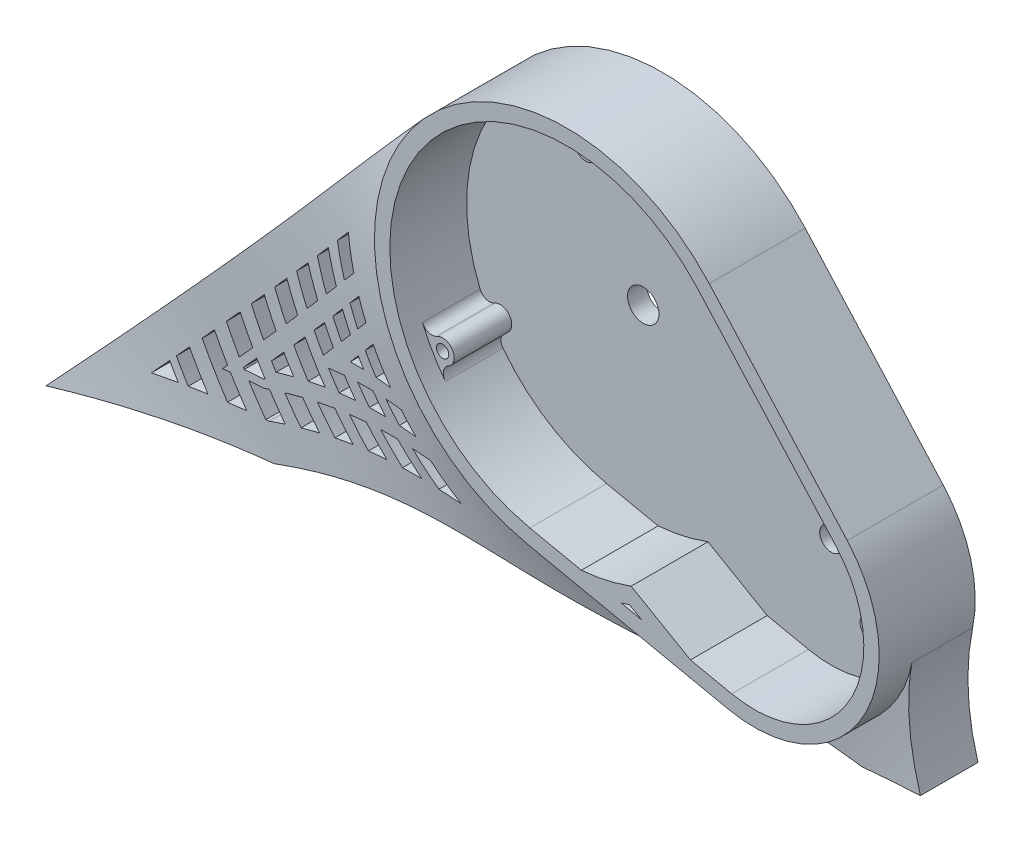
from build123d import *

# Parameters (mm, degrees)
SKETCH1_R           = 32.5
SKETCH1_R_2         = 50
BOSS_EXTRUDE1_DEPTH = 5
BOSS_EXTRUDE3_DEPTH = 20
SKETCH5_R           = 4.1
SKETCH5_R_2         = 3
CUT_EXTRUDE1_DEPTH  = 20
SKETCH6_R           = 3
SKETCH6_R_2         = 1.6
BOSS_EXTRUDE8_DEPTH = 20
CUT_EXTRUDE4_START  = -5
SKETCH8_R           = 46
SKETCH8_R_2         = 28.5
SKETCH8_R_3         = 1.6
CUT_EXTRUDE4_DEPTH  = 5
BOSS_EXTRUDE9_DEPTH = 10
FILLET1_R           = 60
FILLET2_R           = 290
REVOLVE1_ANGLE      = 247
CUT_EXTRUDE7_DEPTH  = 60
CUT_EXTRUDE8_START  = -20
CUT_EXTRUDE8_DEPTH  = 20
SKETCH13_R          = 2
CUT_EXTRUDE9_DEPTH  = 30
SKETCH14_R          = 3.75
CUT_EXTRUDE10_DEPTH = 20
CUT_EXTRUDE11_DEPTH = 30


with BuildPart() as part:
    # Sketch1 → Boss-Extrude1 (new body)
    # profile 1 of 9: a face of its own
    with BuildSketch(Plane.XY):
        with Locations((48.930435314, -28.25)):
            Circle(SKETCH1_R)
    # profile 2 of 9: a face of its own
    with BuildSketch(Plane.XY):
        Circle(SKETCH1_R_2)
    # profile 3 of 9: a face of its own
    with BuildSketch(Plane.XY):
        with Locations((48.930435314, -28.25)):
            Circle(SKETCH1_R)
    # profile 4 of 9: a face of its own
    with BuildSketch(Plane.XY):
        Circle(SKETCH1_R_2)
    # profile 5 of 9: a face of its own
    with BuildSketch(Plane.XY):
        with BuildLine():
            ThreePointArc((21.239981735, -45.264369827), (18.971346468, -46.261085301), (16.656116453, -47.144180815))
            Line((16.656116453, -47.144180815), (32.680435314, -56.395825623))
            ThreePointArc((32.680435314, -56.395825623), (26.266186105, -51.543385495), (21.239981735, -45.264369827))
        make_face()
    # profile 6 of 9: a face of its own
    with BuildSketch(Plane.XY):
        with BuildLine():
            ThreePointArc((16.656116453, -47.144180815), (3.270866111, -49.892899644), (-10.358679178, -48.915209963))
            Line((-10.358679178, -48.915209963), (42.197293848, -60.044886476))
            ThreePointArc((42.197293848, -60.044886476), (37.294924617, -58.59575573), (32.680435314, -56.395825623))
            Line((32.680435314, -56.395825623), (16.656116453, -47.144180815))
        make_face()
        with BuildLine():
            Line((16.444398644, -49.331346558), (19.648032231, -51.180965272))
            Line((19.648032231, -51.180965272), (14.192631254, -50.025685584))
            ThreePointArc((14.192631254, -50.025685584), (15.322448463, -49.691272605), (16.444398644, -49.331346558))
        make_face(mode=Mode.SUBTRACT)
    # profile 7 of 9: a face of its own
    with BuildSketch(Plane.XY):
        Circle(SKETCH1_R_2)
    # profile 8 of 9: a face of its own
    with BuildSketch(Plane.XY):
        with Locations((48.930435314, -28.25)):
            Circle(SKETCH1_R)
    # profile 9 of 9: a face of its own
    with BuildSketch(Plane.XY):
        with BuildLine():
            Line((73.099043979, -6.521485206), (37.18247487, 33.428484299))
            ThreePointArc((37.18247487, 33.428484299), (45.884475161, 19.864917298), (49.820085025, 4.237821155))
            ThreePointArc((49.820085025, 4.237821155), (62.565674459, 1.251360197), (73.099043979, -6.521485206))
        make_face()
    extrude(amount=BOSS_EXTRUDE1_DEPTH)

    # Sketch2 → Boss-Extrude3 (add)
    # profile 1 of 2: a face of its own
    with BuildSketch(Plane.XY.offset(5)):
        with BuildLine():
            ThreePointArc((37.18247487, 33.428484299), (-43.301270189, 25), (-10.358679178, -48.915209963))
            Line((-10.358679178, -48.915209963), (42.197293848, -60.044886476))
            ThreePointArc((42.197293848, -60.044886476), (77.076260937, -44.5), (73.099043979, -6.521485206))
            Line((73.099043979, -6.521485206), (37.18247487, 33.428484299))
        make_face()
        with BuildLine():
            Line((32.282132176, -53.856464122), (19.648032231, -51.180965272))
            Line((19.648032231, -51.180965272), (14.192631254, -50.025685584))
            Line((14.192631254, -50.025685584), (3.883846525, -47.842614228))
            Line((3.883846525, -47.842614228), (-9.529984844, -45.001993166))
            ThreePointArc((-9.529984844, -45.001993166), (-39.837168574, 23), (34.207876881, 30.754205555))
            Line((34.207876881, 30.754205555), (70.12444599, -9.19576395))
            ThreePointArc((70.12444599, -9.19576395), (73.612159322, -42.5), (43.025988182, -56.131669679))
            Line((43.025988182, -56.131669679), (32.282132176, -53.856464122))
        make_face(mode=Mode.SUBTRACT)
    # profile 2 of 2: a face of its own
    with BuildSketch(Plane.XY.offset(5)):
        with BuildLine():
            Line((16.444398644, -49.331346558), (19.648032231, -51.180965272))
            Line((19.648032231, -51.180965272), (32.282132176, -53.856464122))
            Line((32.282132176, -53.856464122), (16.848481272, -44.945841619))
            ThreePointArc((16.848481272, -44.945841619), (10.466860889, -46.844901784), (3.883846525, -47.842614228))
            Line((3.883846525, -47.842614228), (14.192631254, -50.025685584))
            ThreePointArc((14.192631254, -50.025685584), (15.322448463, -49.691272605), (16.444398644, -49.331346558))
        make_face()
    extrude(amount=BOSS_EXTRUDE3_DEPTH)

    # Sketch5 → Cut-Extrude1 (cut)
    with BuildSketch(Plane.XY.offset(5)):
        Circle(SKETCH5_R)
        with Locations((48.930435314, -28.25)):
            Circle(SKETCH5_R_2)
    extrude(amount=-CUT_EXTRUDE1_DEPTH, mode=Mode.SUBTRACT)

    # Sketch6 → Boss-Extrude8 (add)
    # profile 1 of 10: a face of its own
    with BuildSketch(Plane.XY.offset(5)):
        with BuildLine():
            ThreePointArc((-35.739092363, -24.098076211), (-38.015549649, -24.397777438), (-39.83716873, -22.99999973))
            ThreePointArc((-39.83716873, -22.99999973), (-38.255897926, -25.543810873), (-36.512430205, -27.97932166))
            ThreePointArc((-36.512430205, -27.97932166), (-37.004666308, -25.86357718), (-35.739092363, -24.098076211))
        make_face()
    # profile 2 of 10: a face of its own
    with BuildSketch(Plane.XY.offset(5)):
        with Locations((-37.239092363, -21.5)):
            Circle(SKETCH6_R)
        with Locations((-37.239092363, -21.5)):
            Circle(SKETCH6_R_2, mode=Mode.SUBTRACT)
    # profile 3 of 10: a face of its own
    with BuildSketch(Plane.XY.offset(5)):
        with BuildLine():
            ThreePointArc((-38.739092363, -18.901923789), (-40.900848025, -19.115192491), (-42.48701844, -17.631031282))
            ThreePointArc((-42.48701844, -17.631031282), (-41.249538226, -20.358673732), (-39.83716873, -22.99999973))
            ThreePointArc((-39.83716873, -22.99999973), (-40.136869801, -20.723542714), (-38.739092363, -18.901923789))
        make_face()
    # profile 4 of 10: a face of its own
    with BuildSketch(Plane.XY.offset(5)):
        with BuildLine():
            ThreePointArc((-7e-09, 46), (2.121320341, 45.121320346), (3, 43))
            ThreePointArc((3, 43), (3.896181717, 44.978769671), (5.974588235, 45.610352941))
            ThreePointArc((5.974588235, 45.610352941), (2.993640314, 45.902484875), (-7e-09, 46))
        make_face()
    # profile 5 of 10: a face of its own
    with BuildSketch(Plane.XY.offset(5)):
        with Locations((0, 43)):
            Circle(SKETCH6_R)
        with Locations((0, 43)):
            Circle(SKETCH6_R_2, mode=Mode.SUBTRACT)
    # profile 6 of 10: a face of its own
    with BuildSketch(Plane.XY.offset(5)):
        with BuildLine():
            ThreePointArc((-5.974588235, 45.610352941), (-3.896181717, 44.978769671), (-3, 43))
            ThreePointArc((-3, 43), (-2.121320346, 45.121320341), (-7e-09, 46))
            ThreePointArc((-7e-09, 46), (-2.993640321, 45.902484874), (-5.974588235, 45.610352941))
        make_face()
    # profile 7 of 10: a face of its own
    with BuildSketch(Plane.XY.offset(5)):
        with BuildLine():
            Line((77.272100755, -31.25), (74.430435314, -31.25))
            ThreePointArc((74.430435314, -31.25), (76.31803, -32.150518588), (76.80577778, -34.184246575))
            ThreePointArc((76.80577778, -34.184246575), (77.077201474, -32.723204081), (77.272100755, -31.25))
        make_face()
    # profile 8 of 10: a face of its own
    with BuildSketch(Plane.XY.offset(5)):
        with BuildLine():
            ThreePointArc((77.430435314, -28.25), (76.551755657, -30.371320344), (74.430435314, -31.25))
            Line((74.430435314, -31.25), (77.272100755, -31.25))
            ThreePointArc((77.272100755, -31.25), (77.390824147, -29.7520877), (77.430435314, -28.25))
        make_face()
    # profile 9 of 10: a face of its own
    with BuildSketch(Plane.XY.offset(5)):
        with Locations((74.430435314, -28.25)):
            Circle(SKETCH6_R)
        with Locations((74.430435314, -28.25)):
            Circle(SKETCH6_R_2, mode=Mode.SUBTRACT)
    # profile 10 of 10: a face of its own
    with BuildSketch(Plane.XY.offset(5)):
        with BuildLine():
            ThreePointArc((76.80577778, -22.315753425), (76.31803, -24.349481412), (74.430435314, -25.25))
            ThreePointArc((74.430435314, -25.25), (76.551755657, -26.128679656), (77.430435314, -28.25))
            ThreePointArc((77.430435314, -28.25), (77.273840722, -25.266483641), (76.80577778, -22.315753425))
        make_face()
    extrude(amount=BOSS_EXTRUDE8_DEPTH)

    # Sketch8 → Cut-Extrude4 (cut)
    # profile 1 of 7: a face of its own
    with BuildSketch(Plane.XY.offset(25).offset(CUT_EXTRUDE4_START)):
        with BuildLine():
            ThreePointArc((45.999893614, 0.098931644), (42.933181417, 16.514900345), (34.207876881, 30.754205555))
            ThreePointArc((34.207876881, 30.754205555), (21.420408598, 40.708304994), (5.974588235, 45.610352941))
            ThreePointArc((5.974588235, 45.610352941), (3.896181717, 44.978769671), (3, 43))
            ThreePointArc((3, 43), (0, 40), (-3, 43))
            ThreePointArc((-3, 43), (-3.896181717, 44.978769671), (-5.974588235, 45.610352941))
            ThreePointArc((-5.974588235, 45.610352941), (-39.837168574, 23), (-42.48701844, -17.631031282))
            ThreePointArc((-42.48701844, -17.631031282), (-40.900848025, -19.115192491), (-38.739092363, -18.901923789))
            ThreePointArc((-38.739092363, -18.901923789), (-34.641016151, -20), (-35.739092363, -24.098076211))
            ThreePointArc((-35.739092363, -24.098076211), (-37.004666308, -25.86357718), (-36.512430205, -27.97932166))
            ThreePointArc((-36.512430205, -27.97932166), (-24.544221971, -38.904770502), (-9.529984844, -45.001993166))
            ThreePointArc((-9.529984844, -45.001993166), (7.164267468, -45.438675945), (22.91426949, -39.886542263))
            ThreePointArc((22.91426949, -39.886542263), (24.248711306, -14), (45.999893614, 0.098931644))
        make_face()
    # profile 2 of 7: a face of its own
    with BuildSketch(Plane.XY.offset(25).offset(CUT_EXTRUDE4_START)):
        with BuildLine():
            ThreePointArc((70.12444599, -9.19576395), (59.176723242, -1.655572319), (45.999893614, 0.098931644))
            ThreePointArc((45.999893614, 0.098931644), (45.999973404, 0.049465851), (46, 0))
            ThreePointArc((46, 0), (39.812412616, -23.042825385), (22.91426949, -39.886542263))
            ThreePointArc((22.91426949, -39.886542263), (31.022129307, -50.420759481), (43.025988182, -56.131669679))
            ThreePointArc((43.025988182, -56.131669679), (64.457907924, -52.148694406), (76.80577778, -34.184246575))
            ThreePointArc((76.80577778, -34.184246575), (76.31803, -32.150518588), (74.430435314, -31.25))
            ThreePointArc((74.430435314, -31.25), (71.430435314, -28.25), (74.430435314, -25.25))
            ThreePointArc((74.430435314, -25.25), (76.31803, -24.349481412), (76.80577778, -22.315753425))
            ThreePointArc((76.80577778, -22.315753425), (74.326968254, -15.316859832), (70.12444599, -9.19576395))
        make_face()
    # profile 3 of 7: a face of its own
    with BuildSketch(Plane.XY.offset(25).offset(CUT_EXTRUDE4_START)):
        Circle(SKETCH8_R)
    # profile 4 of 7: a face of its own
    with BuildSketch(Plane.XY.offset(25).offset(CUT_EXTRUDE4_START)):
        with Locations((48.930435314, -28.25)):
            Circle(SKETCH8_R_2)
    # profile 5 of 7: a face of its own
    with BuildSketch(Plane.XY.offset(25).offset(CUT_EXTRUDE4_START)):
        with BuildLine():
            ThreePointArc((3, 43), (3.896181717, 44.978769671), (5.974588235, 45.610352941))
            ThreePointArc((5.974588235, 45.610352941), (0, 46), (-5.974588235, 45.610352941))
            ThreePointArc((-5.974588235, 45.610352941), (-3.896181717, 44.978769671), (-3, 43))
            ThreePointArc((-3, 43), (0, 40), (3, 43))
        make_face()
        with Locations((0, 43)):
            Circle(SKETCH8_R_3, mode=Mode.SUBTRACT)
    # profile 6 of 7: a face of its own
    with BuildSketch(Plane.XY.offset(25).offset(CUT_EXTRUDE4_START)):
        with BuildLine():
            ThreePointArc((-38.739092363, -18.901923789), (-40.900848025, -19.115192491), (-42.48701844, -17.631031282))
            ThreePointArc((-42.48701844, -17.631031282), (-39.837168574, -23), (-36.512430205, -27.97932166))
            ThreePointArc((-36.512430205, -27.97932166), (-37.004666308, -25.86357718), (-35.739092363, -24.098076211))
            ThreePointArc((-35.739092363, -24.098076211), (-34.641016151, -20), (-38.739092363, -18.901923789))
        make_face()
        with Locations((-37.239092363, -21.5)):
            Circle(SKETCH8_R_3, mode=Mode.SUBTRACT)
    # profile 7 of 7: a face of its own
    with BuildSketch(Plane.XY.offset(25).offset(CUT_EXTRUDE4_START)):
        with BuildLine():
            ThreePointArc((77.430435314, -28.25), (77.273840722, -25.266483641), (76.80577778, -22.315753425))
            ThreePointArc((76.80577778, -22.315753425), (76.31803, -24.349481412), (74.430435314, -25.25))
            ThreePointArc((74.430435314, -25.25), (71.430435314, -28.25), (74.430435314, -31.25))
            ThreePointArc((74.430435314, -31.25), (76.31803, -32.150518588), (76.80577778, -34.184246575))
            ThreePointArc((76.80577778, -34.184246575), (77.273840722, -31.233516359), (77.430435314, -28.25))
        make_face()
        with Locations((74.430435314, -28.25)):
            Circle(SKETCH8_R_3, mode=Mode.SUBTRACT)
    extrude(amount=CUT_EXTRUDE4_DEPTH, mode=Mode.SUBTRACT)

    # Sketch9 → Boss-Extrude9 (add)
    with BuildSketch(Plane(origin=(0, 0, 0), x_dir=(-1, 0, 0), z_dir=(0, 0, -1))):
        with BuildLine():
            Line((-67.172494488, -65.333836294), (-42.197293848, -60.044886476))
            ThreePointArc((-42.197293848, -60.044886476), (-61.327866171, -58.292531653), (-76.12682551, -46.043435877))
            Line((-76.12682551, -46.043435877), (-82.151340904, -64.537494637))
            Line((-82.151340904, -64.537494637), (-67.172494488, -65.333836294))
        make_face()
        with BuildLine():
            ThreePointArc((37.18247487, 33.428484299), (47.541154048, -15.486725664), (10.358679178, -48.915209963))
            Line((10.358679178, -48.915209963), (85.711958323, -73.461849298))
            Line((85.711958323, -73.461849298), (135.668803504, -76.117775913))
            Line((135.668803504, -76.117775913), (37.18247487, 33.428484299))
        make_face()
    extrude(amount=-BOSS_EXTRUDE9_DEPTH)

    # Fillet1
    # the kernel refuses this fillet: 60 mm, written as the material it adds along each edge
    with BuildSketch(Plane(origin=(76.12682551, -46.043435877, 0), x_dir=(0.3815886364407495, 0.9243322522444457, 0), z_dir=(0, 0, 1))) as fillet1_piece_1_section:
        with BuildLine():
            CenterArc((23.343127723, -58.944504991), FILLET1_R, 100.762888002, 28.705193909)
            Line((-14.795768372, -12.625776548), (-15.558546294, -11.699401979))
            ThreePointArc((-15.558546294, -11.699401979), (-8.176829246, -5.400065951), (-0.77894506, 0.912822323))
            Line((-0.77894506, 0.912822323), (0.224094026, 1.1788901))
            ThreePointArc((0.224094026, 1.1788901), (6.069213208, 0.628273537), (11.91433239, 1.1788901))
            Line((11.91433239, 1.1788901), (12.138426416, 0))
        make_face()
    fillet1_piece_1 = extrude(amount=10, mode=Mode.PRIVATE)
    fillet1_piece_1 = split(fillet1_piece_1, bisect_by=Plane(origin=(79.381235525, -64.684765678, 5), z_dir=(-0.05308944378918359, 0.998589761092189, 0)), keep=Keep.TOP, mode=Mode.PRIVATE)
    add(fillet1_piece_1)

    # Fillet2
    # the kernel refuses this fillet: 290 mm, written as the material it adds along each edge
    with BuildSketch(Plane(origin=(-10.358679178, -48.915209963, 10), x_dir=(0.9783041992533178, -0.20717358355573395, 0), z_dir=(0, 0, -1))) as fillet2_piece_1:
        with BuildLine():
            CenterArc((FILLET2_R * 0.267949192431, FILLET2_R), FILLET2_R, 240, 30)
            Line((-FILLET2_R * 0.232050807569, FILLET2_R * 0.133974596216), (0, 0))
            Line((0, 0), (FILLET2_R * 0.267949192431, 0))
        make_face()
    extrude(amount=10)

    # Sketch10 → Revolve1 (revolve)
    with BuildSketch(Plane(origin=(0, 0, 0), x_dir=(0, 0, -1), z_dir=(1, 0, 0))):
        with BuildLine():
            Line((-25, 50), (-5, 50))
            Line((-5, 50), (-5, 103))
            Line((-5, 103), (-15, 103))
            ThreePointArc((-15, 103), (-17.521862462, 76.03242688), (-25, 50))
        make_face()
        with BuildLine():
            Line((-15, 103), (-5, 103))
            Line((-5, 103), (-5, 156))
            Line((-5, 156), (-25, 156))
            ThreePointArc((-25, 156), (-17.521862462, 129.96757312), (-15, 103))
        make_face()
    revolve(axis=Axis((0, 0, 0), (0, 0, 1)), revolution_arc=REVOLVE1_ANGLE)

    # Sketch11 → Cut-Extrude7 (cut)
    with BuildSketch(Plane(origin=(0, 0, 0), x_dir=(-1, 0, 0), z_dir=(0, 0, -1))):
        with BuildLine():
            Line((-65.660708663, -65.013688341), (-67.172494488, -65.333836294))
            Line((-67.172494488, -65.333836294), (-82.151340904, -64.537494637))
            ThreePointArc((-82.151340904, -64.537494637), (-79.58439421, -49.768168146), (-80.758711095, -34.823496849))
            ThreePointArc((-80.758711095, -34.823496849), (-80.80940732, -34.573064434), (-80.858133115, -34.322241193))
            Line((-80.858133115, -34.322241193), (-143.598757139, -60.954056044))
            ThreePointArc((-143.598757139, -60.954056044), (130.086188242, -86.102169709), (0, 156))
            Line((0, 156), (0, 50))
            ThreePointArc((0, 50), (20.354063293, 45.66959719), (37.18247487, 33.428484299))
            Line((37.18247487, 33.428484299), (135.668803504, -76.117775913))
            Line((135.668803504, -76.117775913), (85.711958323, -73.461849298))
            Line((85.711958323, -73.461849298), (84.242639417, -72.983212646))
            ThreePointArc((84.242639417, -72.983212646), (9.815569267, -59.130875407), (-65.660708663, -65.013688341))
        make_face()
    extrude(amount=-CUT_EXTRUDE7_DEPTH, mode=Mode.SUBTRACT)

    # Sketch12 → Cut-Extrude8 (cut)
    with BuildSketch(Plane.XY.offset(25).offset(CUT_EXTRUDE8_START)):
        with BuildLine():
            ThreePointArc((76.80577778, -34.184246575), (76.831751455, -33.315749192), (76.550347071, -32.493694504))
            Line((76.550347071, -32.493694504), (46.025242673, -19.536556424))
            ThreePointArc((46.025242673, -19.536556424), (35.172990594, -35.536751859), (19.061987701, -46.223810151))
            Line((19.061987701, -46.223810151), (32.282132176, -53.856464122))
            Line((32.282132176, -53.856464122), (43.025988182, -56.131669679))
            ThreePointArc((43.025988182, -56.131669679), (64.457907924, -52.148694406), (76.80577778, -34.184246575))
        make_face()
        with BuildLine():
            Line((19.648032231, -51.180965272), (14.192631254, -50.025685584))
            ThreePointArc((14.192631254, -50.025685584), (15.322448463, -49.691272605), (16.444398644, -49.331346558))
            Line((16.444398644, -49.331346558), (19.648032231, -51.180965272))
        make_face()
        with BuildLine():
            Line((46.025242673, -19.536556424), (76.550347071, -32.493694504))
            ThreePointArc((76.550347071, -32.493694504), (75.659337453, -31.583873666), (74.430435314, -31.25))
            ThreePointArc((74.430435314, -31.25), (71.430435314, -28.25), (74.430435314, -25.25))
            ThreePointArc((74.430435314, -25.25), (76.31803, -24.349481412), (76.80577778, -22.315753425))
            ThreePointArc((76.80577778, -22.315753425), (74.326968254, -15.316859832), (70.12444599, -9.19576395))
            Line((70.12444599, -9.19576395), (34.207876881, 30.754205555))
            ThreePointArc((34.207876881, 30.754205555), (21.420408598, 40.708304994), (5.974588235, 45.610352941))
            ThreePointArc((5.974588235, 45.610352941), (3.896181717, 44.978769671), (3, 43))
            ThreePointArc((3, 43), (0, 40), (-3, 43))
            ThreePointArc((-3, 43), (-3.896181717, 44.978769671), (-5.974588235, 45.610352941))
            ThreePointArc((-5.974588235, 45.610352941), (-39.837168574, 23), (-42.48701844, -17.631031282))
            ThreePointArc((-42.48701844, -17.631031282), (-40.900848025, -19.115192491), (-38.739092363, -18.901923789))
            ThreePointArc((-38.739092363, -18.901923789), (-34.641016151, -20), (-35.739092363, -24.098076211))
            ThreePointArc((-35.739092363, -24.098076211), (-37.004666308, -25.86357718), (-36.512430205, -27.97932166))
            ThreePointArc((-36.512430205, -27.97932166), (-24.544221971, -38.904770502), (-9.529984844, -45.001993166))
            Line((-9.529984844, -45.001993166), (3.883846525, -47.842614228))
            ThreePointArc((3.883846525, -47.842614228), (10.466860889, -46.844901784), (16.848481272, -44.945841619))
            Line((16.848481272, -44.945841619), (19.061987701, -46.223810151))
            ThreePointArc((19.061987701, -46.223810151), (35.172990594, -35.536751859), (46.025242673, -19.536556424))
        make_face()
    extrude(amount=CUT_EXTRUDE8_DEPTH, mode=Mode.SUBTRACT)

    # Sketch13 → Cut-Extrude9 (cut)
    with BuildSketch(Plane(origin=(3.652970503, -68.710814838, 0), x_dir=(0.998589761092189, 0.053089443789183566, 0), z_dir=(0.053089443789183566, -0.998589761092189, 0))):
        with Locations((-124.518528465, 9)):
            Circle(SKETCH13_R)
        with Locations((68.609228193, 10)):
            Circle(SKETCH13_R)
    extrude(amount=-CUT_EXTRUDE9_DEPTH, mode=Mode.SUBTRACT)

    # Sketch14 → Cut-Extrude10 (cut)
    with BuildSketch(Plane(origin=(3.281344397, -61.720686511, 0), x_dir=(-0.998589761092189, -0.053089443789183566, 0), z_dir=(0.053089443789183566, -0.998589761092189, 0))):
        with Locations(Location((-68.609228193, -10, 0), (0, 0, 180))):
            Circle(SKETCH14_R)
        with Locations(Location((124.518528465, -9, 0), (0, 0, 180))):
            Circle(SKETCH14_R)
    extrude(amount=-CUT_EXTRUDE10_DEPTH, mode=Mode.SUBTRACT)

    # Sketch15 → Cut-Extrude11 (cut)
    with BuildSketch(Plane(origin=(0, 0, 0), x_dir=(-1, 0, 0), z_dir=(0, 0, -1))):
        with BuildLine():
            ThreePointArc((48.59815899, -43.963699407), (50.391216812, -41.896457976), (52.096406643, -39.756161002))
            ThreePointArc((52.096406643, -39.756161002), (49.430495803, -39.270380254), (46.760495856, -38.807601875))
            ThreePointArc((46.760495856, -38.807601875), (44.892975915, -40.953566994), (42.927066681, -43.009776589))
            ThreePointArc((42.927066681, -43.009776589), (45.764828204, -43.473567582), (48.59815899, -43.963699407))
        make_face()
        with BuildLine():
            ThreePointArc((54.647984043, -36.168850725), (56.1116684, -33.853634844), (57.477326308, -31.479277045))
            Line((57.477326308, -31.479277045), (54.083613278, -27.704452906))
            ThreePointArc((54.083613278, -27.704452906), (51.936262358, -31.546768271), (49.516407947, -35.223561433))
            ThreePointArc((49.516407947, -35.223561433), (52.084133033, -35.685690716), (54.647984043, -36.168850725))
        make_face()
        with BuildLine():
            ThreePointArc((38.281890767, -53.189141392), (41.84689623, -50.432382441), (45.214008914, -47.43713019))
            ThreePointArc((45.214008914, -47.43713019), (42.182834481, -46.941751984), (39.146833506, -46.476869112))
            ThreePointArc((39.146833506, -46.476869112), (35.235326251, -49.508036923), (31.090150555, -52.210884636))
            ThreePointArc((31.090150555, -52.210884636), (34.688991349, -52.678173743), (38.281890767, -53.189141392))
        make_face()
        with BuildLine():
            Line((55.924814676, -23.76949809), (59.414074818, -27.650599202))
            ThreePointArc((59.414074819, -27.650599202), (60.479042967, -25.236348479), (61.445957171, -22.781182368))
            Line((61.445957171, -22.781182368), (57.806859592, -18.733417203))
            ThreePointArc((57.806859592, -18.733417203), (56.921559717, -21.272281856), (55.924814676, -23.76949809))
        make_face()
        with BuildLine():
            Line((59.089584302, -14.177269237), (62.894266517, -18.409214053))
            ThreePointArc((62.894266517, -18.409214053), (63.933481009, -14.390897431), (64.716239803, -10.314854753))
            Line((64.716239803, -10.314854753), (60.505106117, -5.630814309))
            ThreePointArc((60.505106117, -5.630814309), (59.94983709, -9.929298512), (59.089584302, -14.177269237))
        make_face()
        with BuildLine():
            ThreePointArc((58.864602654, -37.01096218), (61.086880428, -37.478681623), (63.305764673, -37.962244119))
            Line((63.305764673, -37.962244119), (60.301478285, -34.620578906))
            ThreePointArc((60.301478285, -34.620578906), (59.595026593, -35.822975483), (58.864602654, -37.01096218))
        make_face()
        with BuildLine():
            ThreePointArc((58.442863581, -45.878872297), (60.017590225, -43.798722474), (61.518314248, -41.664568147))
            ThreePointArc((61.518314248, -41.664568147), (58.985703867, -41.122061625), (56.448708907, -40.600443715))
            ThreePointArc((56.448708907, -40.600443715), (54.848546848, -42.737450506), (53.167529594, -44.811455723))
            ThreePointArc((53.167529594, -44.811455723), (55.80751667, -45.333697812), (58.442863581, -45.878872297))
        make_face()
        with BuildLine():
            ThreePointArc((49.809488099, -55.131244517), (52.750791424, -52.323925989), (55.534119629, -49.359910694))
            ThreePointArc((55.534119629, -49.359910694), (52.78471597, -48.811749766), (50.030398337, -48.288839387))
            ThreePointArc((50.030398337, -48.288839387), (46.97443326, -51.266513311), (43.741587641, -54.051145019))
            ThreePointArc((43.741587641, -54.051145019), (46.778323095, -54.575547627), (49.809488099, -55.131244517))
        make_face()
        with BuildLine():
            Line((62.306133688, -30.867433842), (65.718471224, -34.662974003))
            ThreePointArc((65.718471224, -34.662974003), (66.880066728, -32.365041345), (67.961342286, -30.028239732))
            Line((67.961342286, -30.028239732), (64.442840792, -26.11461349))
            ThreePointArc((64.442840792, -26.11461349), (63.419026785, -28.511047137), (62.306133688, -30.867433842))
        make_face()
        with BuildLine():
            Line((66.004597708, -21.868832812), (69.636204517, -25.908266001))
            ThreePointArc((69.636204517, -25.908266001), (70.910160231, -22.185319532), (71.985232707, -18.400149425))
            Line((71.985232707, -18.400149425), (68.09424233, -14.072204113))
            ThreePointArc((68.09424233, -14.072204113), (67.162650183, -18.000866298), (66.004597708, -21.868832812))
        make_face()
        with BuildLine():
            Line((72.63401126, -29.24272391), (76.161444719, -33.16628517))
            ThreePointArc((76.161444719, -33.16628517), (77.599504993, -29.645993971), (78.874951827, -26.063578187))
            Line((78.874951827, -26.063578187), (75.164132301, -21.93603676))
            ThreePointArc((75.164132301, -21.93603676), (73.989321725, -25.620631609), (72.63401126, -29.24272391))
        make_face()
        with BuildLine():
            Line((70.111630665, -39.549481541), (71.923262309, -41.564557889))
            ThreePointArc((71.923262309, -41.564557889), (73.156985053, -39.3525561), (74.322698355, -37.103970717))
            Line((74.322698355, -37.103970717), (70.878420047, -33.272902863))
            ThreePointArc((70.878420047, -33.272902863), (69.755715689, -35.566509838), (68.558815279, -37.822286298))
            Line((68.558815279, -37.822286298), (70.111630665, -39.549481541))
        make_face()
        with BuildLine():
            ThreePointArc((67.792803416, -48.007332135), (69.224180737, -45.919287178), (70.591267404, -43.788595548))
            ThreePointArc((70.591267404, -43.788595548), (69.278735793, -43.463726018), (67.964818735, -43.14450602))
            ThreePointArc((67.964818735, -43.14450602), (66.829208811, -42.873422172), (65.69259975, -42.606558549))
            ThreePointArc((65.69259975, -42.606558549), (64.259365293, -44.738914443), (62.756942451, -46.823099721))
            ThreePointArc((62.756942451, -46.823099721), (65.27734696, -47.404695313), (67.792803416, -48.007332135))
        make_face()
        with BuildLine():
            ThreePointArc((60.166834537, -57.275825227), (62.742328755, -54.44233937), (65.184512751, -51.493178491))
            ThreePointArc((65.184512751, -51.493178491), (62.595190713, -50.888600263), (60.000705365, -50.306578586))
            ThreePointArc((60.000705365, -50.306578586), (57.392735997, -53.262654348), (54.639292728, -56.083724765))
            ThreePointArc((54.639292728, -56.083724765), (57.405883961, -56.666697673), (60.166834537, -57.275825227))
        make_face()
        with BuildLine():
            ThreePointArc((74.402740897, -53.840087181), (71.920796395, -53.178077942), (69.433373991, -52.536958197))
            ThreePointArc((69.433373991, -52.536958197), (67.103664119, -55.4817417), (64.649155554, -58.323340838))
            ThreePointArc((64.649155554, -58.323340838), (67.251600246, -58.965082058), (69.848182914, -59.630144929))
            ThreePointArc((69.848182914, -59.630144929), (72.183540002, -56.780801275), (74.402740897, -53.840087181))
        make_face()
        with BuildLine():
            Line((80.57904966, -44.062904994), (77.187056924, -40.289994337))
            ThreePointArc((77.187056924, -40.289994337), (74.69173766, -44.746728659), (71.939380022, -49.049475047))
            ThreePointArc((71.939380022, -49.049475047), (74.375795783, -49.69032059), (76.806915114, -50.350974483))
            ThreePointArc((76.806915114, -50.350974483), (78.755764433, -47.244601906), (80.57904966, -44.062904994))
        make_face()
        with BuildLine():
            ThreePointArc((81.932652054, -29.464655568), (80.5847515, -32.973068193), (79.08669861, -36.420042603))
            Line((79.08669861, -36.420042603), (82.542793222, -40.264253723))
            ThreePointArc((82.542793222, -40.264253723), (84.103500135, -36.89341548), (85.526618935, -33.462221897))
            Line((85.526618935, -33.462221897), (81.932652054, -29.464655568))
        make_face()
        with BuildLine():
            ThreePointArc((88.503837459, -36.773779548), (87.025259533, -40.14778089), (85.418112346, -43.462468758))
            Line((85.418112346, -43.462468758), (88.823854966, -47.250673399))
            ThreePointArc((88.823854966, -47.250673399), (90.480403456, -43.995453607), (92.017704021, -40.682250359))
            Line((92.017704021, -40.682250359), (88.503837459, -36.773779548))
        make_face()
        with BuildLine():
            Line((86.761146547, -50.939246143), (83.406545412, -47.207926132))
            ThreePointArc((83.406545412, -47.207926132), (82.147280244, -49.36663302), (80.832156707, -51.491771667))
            ThreePointArc((80.832156707, -51.491771667), (83.205326661, -52.192012737), (85.572823367, -52.911201542))
            ThreePointArc((85.572823367, -52.911201542), (86.172625866, -51.928623119), (86.761146547, -50.939246143))
        make_face()
        with BuildLine():
            ThreePointArc((83.31294872, -56.402623372), (80.909283138, -55.682446189), (78.49978417, -54.982033361))
            ThreePointArc((78.49978417, -54.982033361), (76.357778741, -57.920028772), (74.105874153, -60.774661853))
            ThreePointArc((74.105874153, -60.774661853), (76.596290237, -61.475479679), (79.080544402, -62.197836335))
            ThreePointArc((79.080544402, -62.197836335), (81.248432449, -59.337977487), (83.31294872, -56.402623372))
        make_face()
        with BuildLine():
            ThreePointArc((88.577737792, -58.055712829), (87.936626349, -57.848812523), (87.295060275, -57.643326291))
            ThreePointArc((87.295060275, -57.643326291), (85.285557121, -60.576846738), (83.177515859, -63.440377282))
            ThreePointArc((83.177515859, -63.440377282), (85.070262794, -64.03615696), (86.959011099, -64.644494226))
            ThreePointArc((86.959011099, -64.644494226), (87.144293253, -64.704917495), (87.329535954, -64.76546161))
            Line((87.329535954, -64.76546161), (88.113255891, -64.807127625))
            ThreePointArc((88.113255891, -64.807127625), (90.399600169, -61.577771507), (92.567646482, -58.267834003))
            Line((92.567646482, -58.267834003), (88.577737792, -58.055712829))
        make_face()
        with BuildLine():
            ThreePointArc((90.627329168, -52.24813702), (90.099066293, -53.153916765), (89.561750857, -54.054355954))
            Line((89.561750857, -54.054355954), (89.607092053, -54.104788927))
            Line((89.607092053, -54.104788927), (89.533652362, -54.100884549))
            ThreePointArc((89.533652362, -54.100884549), (88.981133872, -55.004894593), (88.419488027, -55.903262439))
            ThreePointArc((88.419488027, -55.903262439), (88.682156517, -55.987713564), (88.944749135, -56.072400312))
            Line((88.944749135, -56.072400312), (93.760430839, -56.328423229))
            ThreePointArc((93.760430839, -56.328423229), (93.867521403, -56.149782548), (93.974271606, -55.970938269))
            Line((93.974271606, -55.970938269), (90.627329168, -52.24813702))
        make_face()
        with BuildLine():
            ThreePointArc((94.938238332, -43.930758208), (93.356897796, -47.198201747), (91.663145013, -50.408813322))
            Line((91.663145013, -50.408813322), (95.031863487, -54.155836037))
            ThreePointArc((95.031863487, -54.155836037), (96.765735259, -50.993157721), (98.394389713, -47.775032472))
            Line((98.394389713, -47.775032472), (94.938238332, -43.930758208))
        make_face()
        with BuildLine():
            ThreePointArc((101.273257053, -50.977194185), (99.608661341, -54.15774651), (97.844210211, -57.284006925))
            Line((97.844210211, -57.284006925), (99.037970056, -58.611824992))
            Line((99.037970056, -58.611824992), (97.11625421, -58.509658087))
            ThreePointArc((97.11625421, -58.509658087), (95.042565721, -61.821174547), (92.856006233, -65.059273188))
            Line((92.856006233, -65.059273188), (97.533857938, -65.307968453))
            ThreePointArc((97.533857938, -65.307968453), (100.989143429, -59.826224161), (104.136663687, -54.162158966))
            Line((104.136663687, -54.162158966), (101.273257053, -50.977194185))
        make_face()
        with BuildLine():
            Line((109.823796801, -60.48795233), (106.986349688, -57.3318623))
            ThreePointArc((106.986349688, -57.3318623), (104.651676393, -61.490227536), (102.155457025, -65.55367308))
            Line((102.155457025, -65.55367308), (106.727899471, -65.796764323))
            ThreePointArc((106.727899471, -65.796764323), (108.30837992, -63.161329625), (109.823796801, -60.48795233))
        make_face()
        with BuildLine():
            Line((114.991603483, -66.23609934), (111.238335036, -62.061342014))
            ThreePointArc((111.238335036, -62.061342014), (110.134829088, -63.999193556), (108.997567803, -65.917429919))
            Line((108.997567803, -65.917429919), (114.991603483, -66.23609934))
        make_face()
    extrude(amount=-CUT_EXTRUDE11_DEPTH, mode=Mode.SUBTRACT)


solid = part.part
